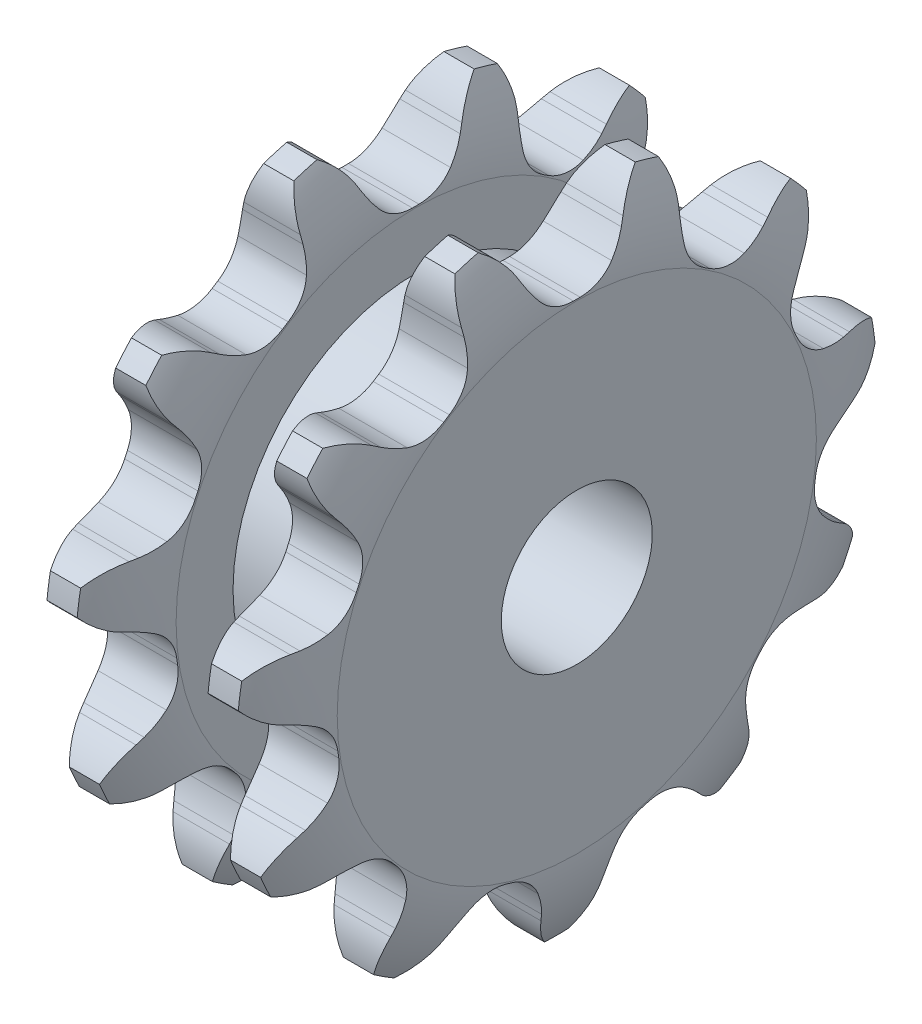
from build123d import *

# Parameters (mm, degrees)
TOOTHCUT_DEPTH  = 21.202424298
TEETHCUTS_COUNT = 11
TEETHCUTS_ANGLE = 327.272727273
BORSKE_R        = 3
BORE_DEPTH      = 95.0005


with BuildPart() as part:
    # BasProSke → Base-Revolve (revolve)
    with BuildSketch(Plane(origin=(0, 0, 0), x_dir=(1, 0, 0), z_dir=(0, 1, 0))):
        with BuildLine():
            Line((0, 0), (0, 9.518056997))
            ThreePointArc((0, 9.518056997), (0.203030999, 11.167299247), (0.8, 12.718056997))
            Line((0.8, 12.718056997), (8.4, 12.718056997))
            ThreePointArc((8.4, 12.718056997), (8.996969001, 11.167299247), (9.2, 9.518056997))
            Line((9.2, 9.518056997), (9.2, 0))
            Line((9.2, 0), (0, 0))
        make_face()
    revolve(axis=Axis((-10, 0, 0), (1, 0, 0)))

    # GrvSke → Groove (revolve, cut)
    with BuildSketch(Plane(origin=(0, 0, 0), x_dir=(1, 0, 0), z_dir=(0, 1, 0))):
        with BuildLine():
            Line((2.8, 9.518056997), (2.8, 7.257056997))
            Line((2.8, 7.257056997), (6.4, 7.257056997))
            Line((6.4, 7.257056997), (6.4, 9.518056997))
            ThreePointArc((6.4, 9.518056997), (6.603030999, 11.167299247), (7.2, 12.718056997))
            Line((7.2, 12.718056997), (2, 12.718056997))
            ThreePointArc((2, 12.718056997), (2.596969001, 11.167299247), (2.8, 9.518056997))
        make_face()
    revolve(axis=Axis((0, 0, 0), (1, 0, 0)), mode=Mode.SUBTRACT)

    # TooCutSke → ToothCut (cut, through all)
    with BuildSketch(Plane(origin=(0, 0, 0), x_dir=(0, 0, -1), z_dir=(1, 0, 0))):
        with BuildLine():
            Line((1.969240642, 10.976206637), (2.110899652, 11.247804771))
            ThreePointArc((2.110899652, 11.247804771), (3.131182223, 12.335851112), (4.567724119, 12.73730939))
            ThreePointArc((4.567724119, 12.73730939), (0, 13.531561407), (-4.567724119, 12.73730939))
            ThreePointArc((-4.567724119, 12.73730939), (-3.131182223, 12.335851112), (-2.110899652, 11.247804771))
            Line((-2.110899652, 11.247804771), (-1.969240642, 10.976206637))
            ThreePointArc((-1.969240642, 10.976206637), (-1.719287929, 10.556452911), (-1.423732986, 10.167458277))
            ThreePointArc((-1.423732986, 10.167458277), (-0.84340558, 9.727618527), (-0.13218, 9.571422887))
            Line((-0.13218, 9.571422887), (0.13218, 9.571422887))
            ThreePointArc((0.13218, 9.571422887), (0.84340558, 9.727618527), (1.423732986, 10.167458277))
            ThreePointArc((1.423732986, 10.167458277), (1.719287929, 10.556452911), (1.969240642, 10.976206637))
        make_face()
    toothcut = extrude(amount=TOOTHCUT_DEPTH, mode=Mode.SUBTRACT)

    # TeethCuts: ToothCut ×11 about axis
    teethcuts_axis = Axis((-10, 0, 0), (1, 0, 0))
    for i in range(1, TEETHCUTS_COUNT):
        add(toothcut.rotate(teethcuts_axis, i * TEETHCUTS_ANGLE / (TEETHCUTS_COUNT - 1)), mode=Mode.SUBTRACT)

    # BorSke → Bore (cut, symmetric)
    with BuildSketch(Plane(origin=(0, 0, 0), x_dir=(0, 0, -1), z_dir=(1, 0, 0))):
        Circle(BORSKE_R)
    extrude(amount=BORE_DEPTH, both=True, mode=Mode.SUBTRACT)


solid = part.part
